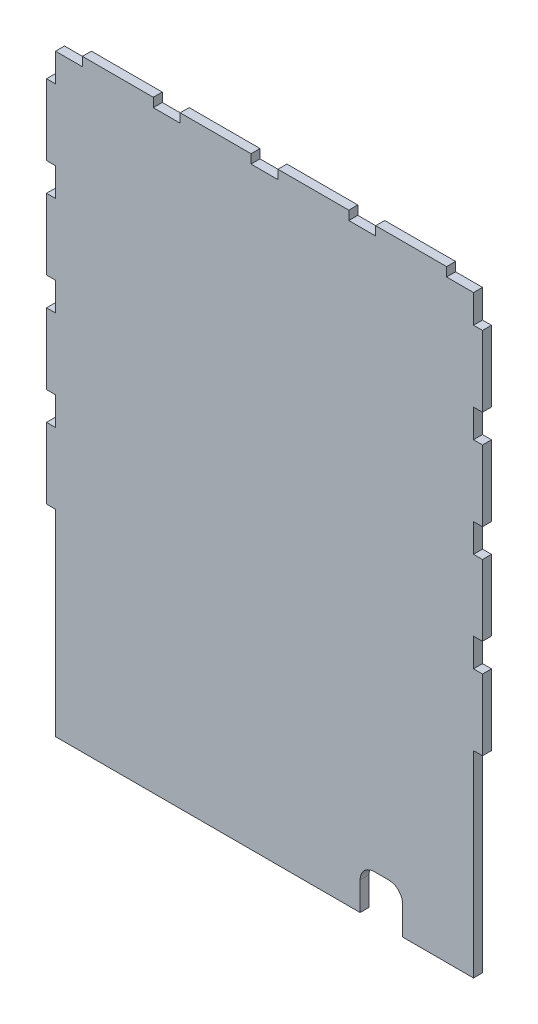
from build123d import *

# Parameters (mm, degrees)
BOSS_EXTRUDE1_DEPTH = 6.35
SKETCH3_W           = 30
SKETCH3_H           = 30
CUT_EXTRUDE1_DEPTH  = 517.127896843
FILLET1_R           = 10


with BuildPart() as part:
    # Sketch2 → Boss-Extrude1 (new body)
    with BuildSketch(Plane.XY):
        Polygon((0, 0), (19, 0), (19, 6.35), (69, 6.35), (69, 0), (88, 0), (88, 6.35), (138, 6.35), (138, 0), (157, 0), (157, 6.35), (207, 6.35), (207, 0), (226, 0), (226, 6.35), (276, 6.35), (276, 0), (295, 0), (295, -20), (301.35, -20), (301.35, -70), (295, -70), (295, -90), (301.35, -90), (301.35, -140), (295, -140), (295, -160), (301.35, -160), (301.35, -210), (295, -210), (295, -230), (301.35, -230), (301.35, -280), (295, -280), (295, -418.97), (0, -418.97), (0, -280), (-6.35, -280), (-6.35, -230), (0, -230), (0, -210), (-6.35, -210), (-6.35, -160), (0, -160), (0, -140), (-6.35, -140), (-6.35, -90), (0, -90), (0, -70), (-6.35, -70), (-6.35, -20), (0, -20), align=None)
    extrude(amount=BOSS_EXTRUDE1_DEPTH)

    # Sketch3 → Cut-Extrude1 (cut, through all)
    with BuildSketch(Plane.XY.offset(6.35)):
        with Locations((230, -403.97)):
            Rectangle(SKETCH3_W, SKETCH3_H)
    extrude(amount=-CUT_EXTRUDE1_DEPTH, mode=Mode.SUBTRACT)

    # Fillet1
    fillet1_edges = [part.edges().sort_by_distance(p)[0] for p in [
        (245, -388.97, 3.175),
        (215, -388.97, 3.175),
    ]]
    fillet(fillet1_edges, radius=FILLET1_R)


solid = part.part
